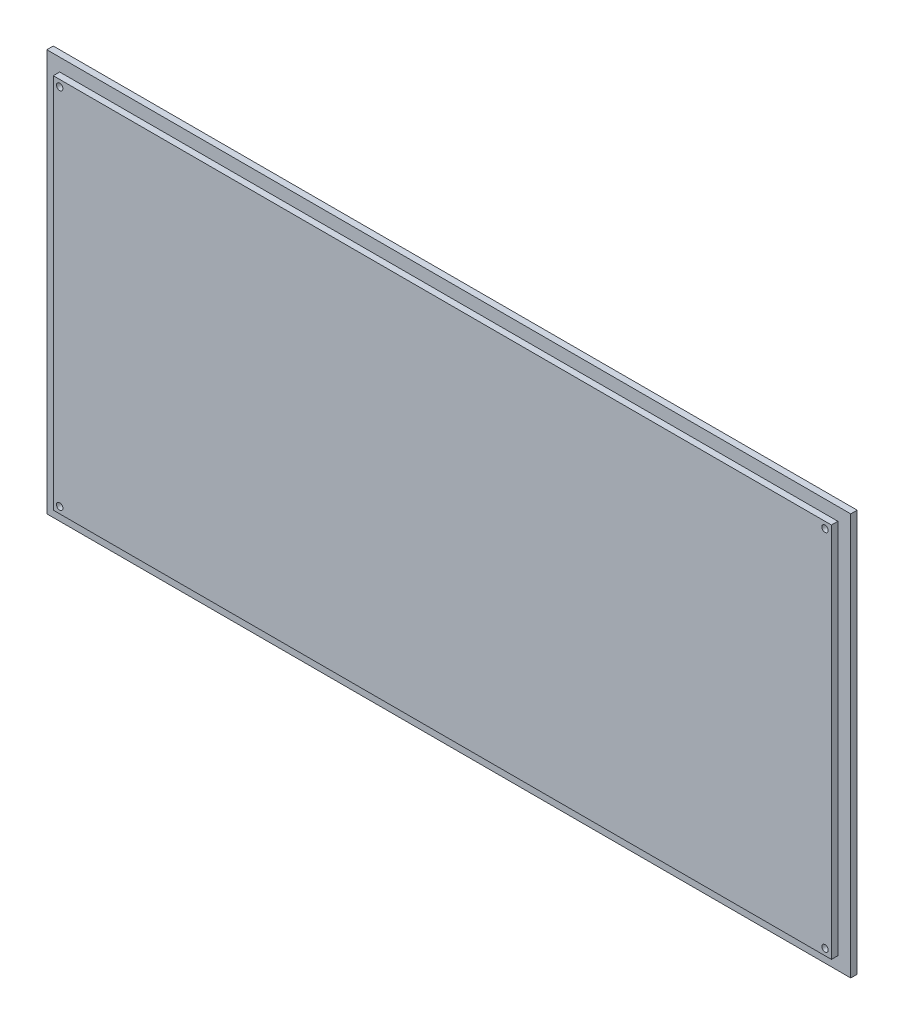
from build123d import *

# Parameters (mm, degrees)
SKIZZE1_W                       = 250
SKIZZE1_H                       = 125
AUFSATZ_LINEAR_AUSTRAGEN1_DEPTH = 2
SKIZZE2_W                       = 242
SKIZZE2_H                       = 117
AUFSATZ_LINEAR_AUSTRAGEN2_DEPTH = 2
SKIZZE3_R                       = 1
SCHNITT_LINEAR_AUSTRAGEN1_DEPTH = 32


with BuildPart() as part:
    # Skizze1 → Aufsatz-Linear austragen1 (new body)
    with BuildSketch(Plane.XY):
        with Locations((125, 62.5)):
            Rectangle(SKIZZE1_W, SKIZZE1_H)
    extrude(amount=AUFSATZ_LINEAR_AUSTRAGEN1_DEPTH)

    # Skizze2 → Aufsatz-Linear austragen2 (add)
    with BuildSketch(Plane.XY.offset(2)):
        with Locations((125, 62.5)):
            Rectangle(SKIZZE2_W, SKIZZE2_H)
    extrude(amount=AUFSATZ_LINEAR_AUSTRAGEN2_DEPTH)

    # Skizze3 → Schnitt-Linear austragen1 (cut)
    with BuildSketch(Plane.XY.offset(4)):
        with Locations((6, 119)):
            Circle(SKIZZE3_R)
        with Locations((6, 6)):
            Circle(SKIZZE3_R)
        with Locations((244, 6)):
            Circle(SKIZZE3_R)
        with Locations((244, 119)):
            Circle(SKIZZE3_R)
    extrude(amount=-SCHNITT_LINEAR_AUSTRAGEN1_DEPTH, mode=Mode.SUBTRACT)


solid = part.part
